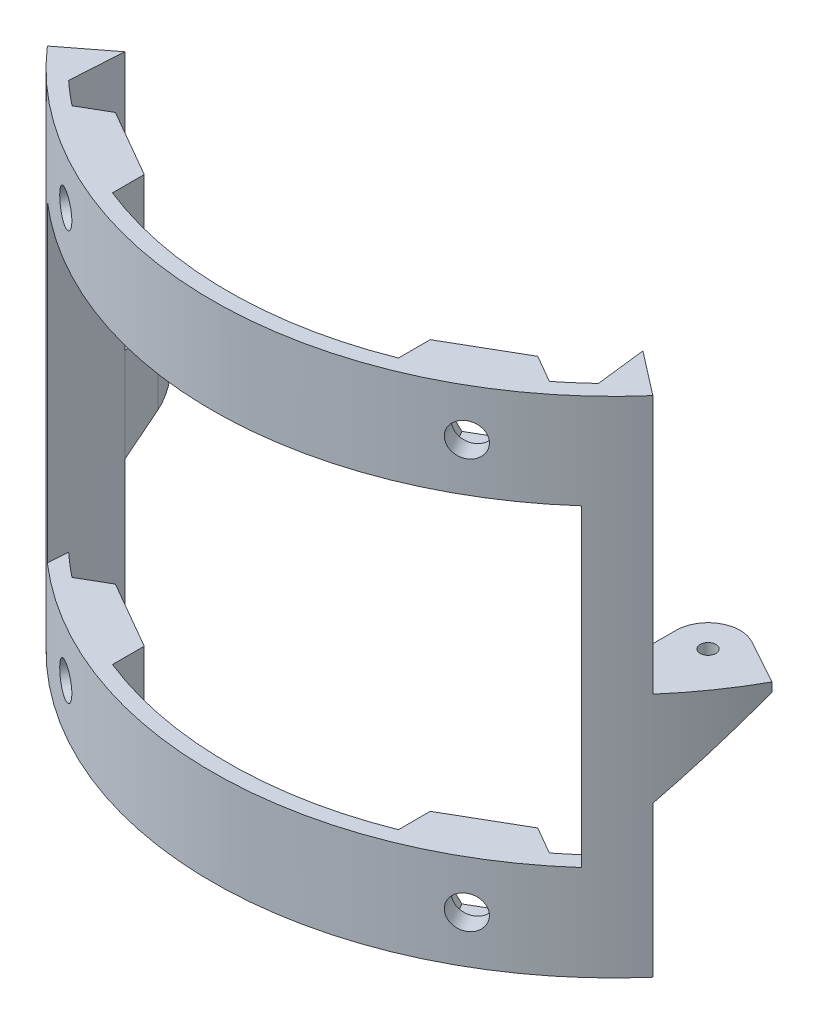
from build123d import *

# Parameters (mm, degrees)
EXTRUDE_1_DEPTH        = 19.9
EXTRUDE_1_DEPTH_BACK   = 19.9
EXTRUDE_1_2_DEPTH      = 19.9
EXTRUDE_1_2_DEPTH_BACK = 19.9
EXTRUDE_2_DEPTH        = 12.1
EXTRUDE_4_DEPTH        = 12.1
EXTRUDE_5_DEPTH        = 12.1
SKETCH_4_R             = 2.1
CUT_EXTRUDE_1_DEPTH    = 74.077252942
CUT_EXTRUDE_2_DEPTH    = 3.5
SKETCH_9_R             = 1
EXTRUDE_6_DEPTH        = 12
DRAFT_START            = -52
DRAFT_3_DEPTH          = 11.517207928
DRAFT_START_2          = 40.482792072
DRAFT_5_DEPTH          = 11.517207928
SKETCH_10_R            = 2
CUT_EXTRUDE_3_DEPTH    = 77.242064239


with BuildPart() as part:
    # Эскиз1 → Бобышка-Вытянуть1 (new, two sides: drawn at the far end of the back side and taken through both)
    with BuildSketch(Plane(origin=(0, 0, 0), x_dir=(1, 0, 0), z_dir=(0, 1, 0)).offset(-EXTRUDE_1_DEPTH_BACK)):
        with BuildLine():
            Line((38.470009909, -33.482209271), (32.917480236, -29.196566492))
            Line((32.917480236, -29.196566492), (33.95705193, -38.051525912))
            ThreePointArc((33.95705193, -38.051525912), (36.285527215, -35.837975874), (38.470009909, -33.482209271))
        make_face()
    extrude(amount=EXTRUDE_1_DEPTH + EXTRUDE_1_DEPTH_BACK)



with BuildPart() as body_2:
    # Эскиз1 → Extrude 1 2 (new, two sides: drawn at the far end of the back side and taken through both)
    with BuildSketch(Plane(origin=(0, 0, 0), x_dir=(1, 0, 0), z_dir=(0, 1, 0)).offset(-EXTRUDE_1_2_DEPTH_BACK)):
        with BuildLine():
            Line((-32.917480236, -29.196566492), (-38.470009909, -33.482209271))
            ThreePointArc((-38.470009909, -33.482209271), (-36.064957562, -36.059933944), (-33.487567945, -38.465345353))
            Line((-33.487567945, -38.465345353), (-32.917480236, -29.196566492))
        make_face()
    extrude(amount=EXTRUDE_1_2_DEPTH + EXTRUDE_1_2_DEPTH_BACK)


with BuildPart() as part_1:
    add(part.part)

    add(body_2.part)  # Бобышка-Вытянуть2 merges body 2
    # Эскиз2 → Бобышка-Вытянуть2 (add)
    with BuildSketch(Plane(origin=(0, 19.9, 0), x_dir=(1, 0, 0), z_dir=(0, 1, 0))):
        with BuildLine():
            Line((-32.917480236, -29.196566492), (-38.470009909, -33.482209271))
            ThreePointArc((-38.470009909, -33.482209271), (-36.064957562, -36.059933944), (-33.487567945, -38.465345353))
            ThreePointArc((-33.487567945, -38.465345353), (0.312914422, -50.999040036), (33.95705193, -38.051525912))
            ThreePointArc((33.95705193, -38.051525912), (36.285527215, -35.837975874), (38.470009909, -33.482209271))
            Line((38.470009909, -33.482209271), (32.917480236, -29.196566492))
            Line((32.917480236, -29.196566492), (33.669275707, -35.60027912))
            ThreePointArc((33.669275707, -35.60027912), (0.231869073, -48.999451392), (-33.33084903, -35.917328727))
            Line((-33.33084903, -35.917328727), (-32.917480236, -29.196566492))
        make_face()
    extrude_2 = extrude(amount=EXTRUDE_2_DEPTH)

    # Зеркальное отражение4: Бобышка-Вытянуть2 across plane
    add(extrude_2.mirror(Plane.ZX))

    # Эскиз5 → Бобышка-Вытянуть4 (add)
    with BuildSketch(Plane(origin=(0, 32, 0), x_dir=(1, 0, 0), z_dir=(0, 1, 0))):
        with BuildLine():
            Line((-18.169872981, -41.47114317), (-26.830127019, -36.47114317))
            Line((-26.830127019, -36.47114317), (-30.324983414, -38.488899451))
            ThreePointArc((-30.324983414, -38.488899451), (-24.5, -42.435244785), (-18.169872981, -45.506655731))
            Line((-18.169872981, -45.506655731), (-18.169872981, -41.47114317))
        make_face()
        with BuildLine():
            Line((26.830127019, -36.47114317), (30.324983414, -38.488899451))
            ThreePointArc((30.324983414, -38.488899451), (24.5, -42.435244785), (18.169872981, -45.506655731))
            Line((18.169872981, -45.506655731), (18.169872981, -41.47114317))
            Line((18.169872981, -41.47114317), (26.830127019, -36.47114317))
        make_face()
    extrude(amount=-EXTRUDE_4_DEPTH)

    # Эскиз6 → Бобышка-Вытянуть5 (add)
    with BuildSketch(Plane.XZ.offset(32)):
        with BuildLine():
            Line((18.169872981, 41.47114317), (18.169872981, 45.506655731))
            ThreePointArc((18.169872981, 45.506655731), (24.5, 42.435244785), (30.324983414, 38.488899451))
            Line((30.324983414, 38.488899451), (26.830127019, 36.47114317))
            Line((26.830127019, 36.47114317), (18.169872981, 41.47114317))
        make_face()
        with BuildLine():
            Line((-26.830127019, 36.47114317), (-30.324983414, 38.488899451))
            ThreePointArc((-30.324983414, 38.488899451), (-24.5, 42.435244785), (-18.169872981, 45.506655731))
            Line((-18.169872981, 45.506655731), (-18.169872981, 41.47114317))
            Line((-18.169872981, 41.47114317), (-26.830127019, 36.47114317))
        make_face()
    extrude(amount=-EXTRUDE_5_DEPTH)

    # Эскиз4 → Вырез-Вытянуть1 (cut, through all)
    with BuildSketch(Plane(origin=(-25.5, 0, 44.167295593), x_dir=(0.8660254037844417, 0, 0.4999999999999947), z_dir=(-0.4999999999999947, 0, 0.8660254037844417))):
        with Locations((0, -26)):
            Circle(SKETCH_4_R)
        with Locations((0, 26)):
            Circle(SKETCH_4_R)
    cut_extrude_1 = extrude(amount=-CUT_EXTRUDE_1_DEPTH, mode=Mode.SUBTRACT)

    # Зеркальное отражение5: Вырез-Вытянуть1 across plane
    add(cut_extrude_1.mirror(Plane(origin=(0, 0, 0), x_dir=(0, 0, 1), z_dir=(1, 0, 0))), mode=Mode.SUBTRACT)

    # Эскиз7 → Вырез-Вытянуть2 (cut)
    with BuildSketch(Plane(origin=(-22.5, 0, 38.97114317), x_dir=(-0.866025403784438, 0, -0.5000000000000011), z_dir=(0.5000000000000011, 0, -0.8660254037844382))):
        Polygon((4.099186911, 26), (2.049593456, 29.55), (-2.049593456, 29.55), (-4.099186911, 26), (-2.049593456, 22.45), (2.049593456, 22.45), align=None)
        Polygon((2.049593456, -22.45), (4.099186911, -26), (2.049593456, -29.55), (-2.049593456, -29.55), (-4.099186911, -26), (-2.049593456, -22.45), align=None)
    cut_extrude_2 = extrude(amount=-CUT_EXTRUDE_2_DEPTH, mode=Mode.SUBTRACT)

    # Зеркальное отражение7: Вырез-Вытянуть2 across plane
    add(cut_extrude_2.mirror(Plane(origin=(0, 0, 0), x_dir=(0, 0, 1), z_dir=(1, 0, 0))), mode=Mode.SUBTRACT)

    # Эскиз9 → Бобышка-Вытянуть6 (add)
    # profile 1 of 2: a face of its own
    with BuildSketch(Plane(origin=(0, -0.85, 0), x_dir=(-1, 0, 0), z_dir=(0, -1, 0))):
        with BuildLine():
            ThreePointArc((-44.691496308, -24.569699993), (-41.818862185, -29.192169593), (-38.470009909, -33.482209271))
            Line((-38.470009909, -33.482209271), (-32.917480236, -29.196566492))
            Line((-32.917480236, -29.196566492), (-32.917480236, -25))
            ThreePointArc((-32.917480236, -25), (-34.921838684, -21.485997557), (-38.966789918, -21.422472216))
            Line((-38.966789918, -21.422472216), (-44.691496308, -24.569699993))
        make_face()
        with Locations(Location((-37, -25, 0), (0, 0, 90))):
            Circle(SKETCH_9_R, mode=Mode.SUBTRACT)
    # profile 2 of 2: a face of its own
    with BuildSketch(Plane(origin=(0, -0.85, 0), x_dir=(-1, 0, 0), z_dir=(0, -1, 0))):
        with BuildLine():
            ThreePointArc((38.470009909, -33.482209271), (41.818862185, -29.192169593), (44.691496308, -24.569699993))
            Line((44.691496308, -24.569699993), (38.966789918, -21.422472216))
            ThreePointArc((38.966789918, -21.422472216), (34.921838684, -21.485997557), (32.917480236, -25))
            Line((32.917480236, -25), (32.917480236, -29.196566492))
            Line((32.917480236, -29.196566492), (38.470009909, -33.482209271))
        make_face()
        with Locations(Location((37, -25, 0), (0, 0, 90))):
            Circle(SKETCH_9_R, mode=Mode.SUBTRACT)
    extrude(amount=EXTRUDE_6_DEPTH)

    # Уклон3: read off the stored shape, not the designer's step
    # Уклон3 outline → Уклон3 (cut)
    with BuildSketch(Plane(origin=(0, 0, 0), x_dir=(0.6110056787485416, 0, 0.7916262126389156), z_dir=(0.7916262126389156, 0, -0.611005678748542)).offset(DRAFT_START)):
        Polygon((-9, 0.85), (3, 12.85), (-9, 12.85), align=None)
    extrude(amount=DRAFT_3_DEPTH, mode=Mode.SUBTRACT)

    # Уклон5: read off the stored shape, not the designer's step
    # Уклон5 outline → Уклон5 (cut)
    with BuildSketch(Plane(origin=(0, 0, 0), x_dir=(0.6110056787485442, 0, -0.7916262126389138), z_dir=(0.7916262126389138, 0, 0.6110056787485444)).offset(DRAFT_START_2)):
        Polygon((9, -0.85), (-3, -12.85), (9, -12.85), align=None)
    extrude(amount=DRAFT_5_DEPTH, mode=Mode.SUBTRACT)

    # Эскиз10 → Вырез-Вытянуть3 (cut, through all)
    with BuildSketch(Plane(origin=(0, -2.85, 0), x_dir=(1, 0, 0), z_dir=(0, 1, 0))):
        with Locations(Location((-37, -25, 0), (0, 0, 270))):
            Circle(SKETCH_10_R)
        with Locations(Location((37, -25, 0), (0, 0, 52.337744339))):
            Circle(SKETCH_10_R)
    extrude(amount=-CUT_EXTRUDE_3_DEPTH, mode=Mode.SUBTRACT)


solid = part_1.part
